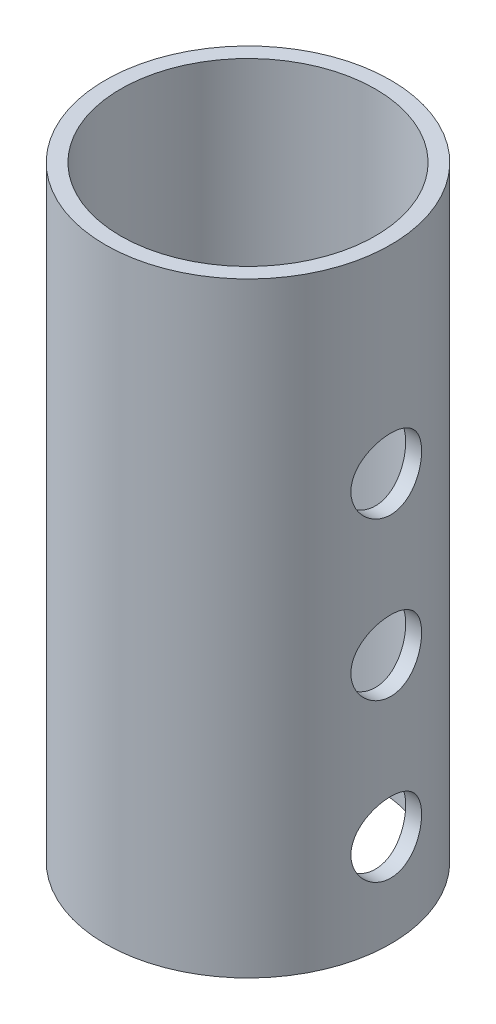
from build123d import *

# Parameters (mm, degrees)
SKETCH1_R           = 46.53
SKETCH1_R_2         = 41.53
BOSS_EXTRUDE1_DEPTH = 197.41
SKETCH2_R           = 11.53
CUT_EXTRUDE1_DEPTH  = 209.088418467
SKETCH4_R           = 7.5
CUT_EXTRUDE2_DEPTH  = 209.088418606


with BuildPart() as part:
    # Sketch1 → Boss-Extrude1 (new body)
    with BuildSketch(Plane(origin=(0, 0, 0), x_dir=(1, 0, 0), z_dir=(0, 1, 0))):
        Circle(SKETCH1_R)
        Circle(SKETCH1_R_2, mode=Mode.SUBTRACT)
    extrude(amount=BOSS_EXTRUDE1_DEPTH)

    # Sketch2 → Cut-Extrude1 (cut, through all)
    with BuildSketch(Plane(origin=(0, 0, 0), x_dir=(0, 0, -1), z_dir=(1, 0, 0))):
        with Locations((0, 132.71)):
            Circle(SKETCH2_R)
        with Locations((0, 81.41)):
            Circle(SKETCH2_R)
        with Locations((0, 30.11)):
            Circle(SKETCH2_R)
    extrude(amount=CUT_EXTRUDE1_DEPTH, mode=Mode.SUBTRACT)

    # Sketch4 → Cut-Extrude2 (cut, through all)
    with BuildSketch(Plane(origin=(0, 0, 0), x_dir=(0, 0, -1), z_dir=(1, 0, 0))):
        with Locations((0, 106.91)):
            Circle(SKETCH4_R)
    extrude(amount=-CUT_EXTRUDE2_DEPTH, mode=Mode.SUBTRACT)


solid = part.part
